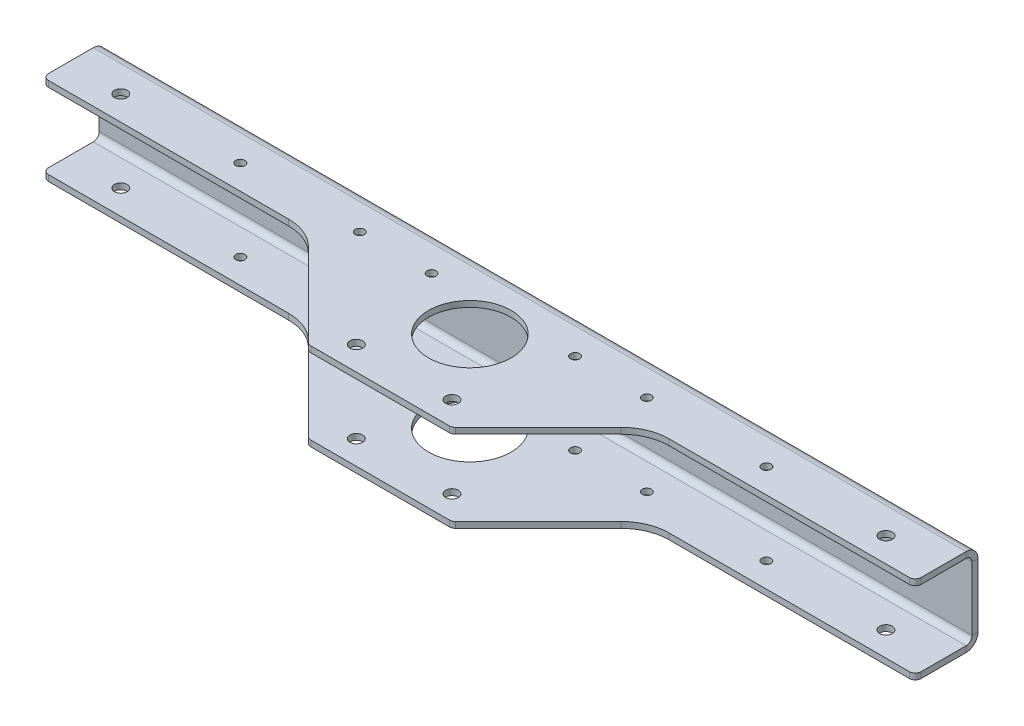
from build123d import *

# Parameters (mm, degrees)
BASE_FLANGE1_DEPTH = 463.55
SKETCH6_R          = 21.9075
CUT_EXTRUDE1_DEPTH = 474.696057033
CUT_EXTRUDE2_DEPTH = 474.696057033
SKETCH8_R          = 3.3782
SKETCH8_R_2        = 2.4257
CUT_EXTRUDE3_DEPTH = 474.696057033
SKETCH9_R          = 3.3782
CUT_EXTRUDE4_DEPTH = 474.696057033
FILLET1_R          = 25.4
FILLET2_R          = 3.175


# Sheet-metal steps are written as plain solids
with BuildPart() as part:
    # Sketch1 → Base-Flange1 (new body)
    with BuildSketch(Plane(origin=(0, 0, 0), x_dir=(0, 0, -1), z_dir=(1, 0, 0))):
        with BuildLine():
            Line((0, 0), (79.375, 0))
            ThreePointArc((79.375, 0), (81.62006403, 0.92993597), (82.55, 3.175))
            Line((82.55, 3.175), (82.55, 36.957))
            ThreePointArc((82.55, 36.957), (81.62006403, 39.20206403), (79.375, 40.132))
            Line((79.375, 40.132), (0, 40.132))
            Line((0, 40.132), (0, 43.307))
            Line((0, 43.307), (79.375, 43.307))
            ThreePointArc((79.375, 43.307), (83.865128061, 41.447128061), (85.725, 36.957))
            Line((85.725, 36.957), (85.725, 3.175))
            ThreePointArc((85.725, 3.175), (83.865128061, -1.315128061), (79.375, -3.175))
            Line((79.375, -3.175), (0, -3.175))
            Line((0, -3.175), (0, 0))
        make_face()
    extrude(amount=BASE_FLANGE1_DEPTH)

    # Sketch6 → Cut-Extrude1 (cut, through all)
    with BuildSketch(Plane(origin=(0, 43.307, 0), x_dir=(1, 0, 0), z_dir=(0, 1, 0))):
        with Locations(Location((231.775, 47.625, 0), (0, 0, 270))):
            Circle(SKETCH6_R)
    extrude(amount=-CUT_EXTRUDE1_DEPTH, mode=Mode.SUBTRACT)

    # Sketch7 → Cut-Extrude2 (cut, through all)
    with BuildSketch(Plane(origin=(0, 43.307, 0), x_dir=(1, 0, 0), z_dir=(0, 1, 0))):
        Polygon((141.2748, 52.4002), (0, 52.4002), (0, 0), (193.675, 0), align=None)
        Polygon((322.2752, 52.4002), (269.875, 0), (463.55, 0), (463.55, 52.4002), align=None)
    extrude(amount=-CUT_EXTRUDE2_DEPTH, mode=Mode.SUBTRACT)

    # Sketch8 → Cut-Extrude3 (cut, through all)
    with BuildSketch(Plane(origin=(0, 43.307, 0), x_dir=(1, 0, 0), z_dir=(0, 1, 0))):
        with Locations(Location((28.575, 65.405, 0), (0, 0, 270))):
            Circle(SKETCH8_R)
        with Locations(Location((92.075, 65.405, 0), (0, 0, 270))):
            Circle(SKETCH8_R_2)
        with Locations(Location((193.675, 65.405, 0), (0, 0, 270))):
            Circle(SKETCH8_R_2)
        with Locations(Location((269.875, 65.405, 0), (0, 0, 270))):
            Circle(SKETCH8_R_2)
        with Locations(Location((371.475, 65.405, 0), (0, 0, 270))):
            Circle(SKETCH8_R_2)
        with Locations(Location((434.975, 65.405, 0), (0, 0, 270))):
            Circle(SKETCH8_R)
        with Locations(Location((155.575, 65.405, 0), (0, 0, 270))):
            Circle(SKETCH8_R_2)
        with Locations(Location((307.975, 65.405, 0), (0, 0, 270))):
            Circle(SKETCH8_R_2)
    extrude(amount=-CUT_EXTRUDE3_DEPTH, mode=Mode.SUBTRACT)

    # Sketch9 → Cut-Extrude4 (cut, through all)
    with BuildSketch(Plane(origin=(0, 43.307, 0), x_dir=(1, 0, 0), z_dir=(0, 1, 0))):
        with Locations(Location((257.175, 12.7, 0), (0, 0, 270))):
            Circle(SKETCH9_R)
        with Locations(Location((206.375, 12.7, 0), (0, 0, 270))):
            Circle(SKETCH9_R)
    extrude(amount=-CUT_EXTRUDE4_DEPTH, mode=Mode.SUBTRACT)

    # Fillet1
    fillet1_edges = [part.edges().sort_by_distance(p)[0] for p in [
        (141.2748, 41.7195, -52.4002),
        (141.2748, -1.5875, -52.4002),
        (322.2752, 41.7195, -52.4002),
        (322.2752, -1.5875, -52.4002),
    ]]
    fillet(fillet1_edges, radius=FILLET1_R)

    # Fillet2
    fillet2_edges = [part.edges().sort_by_distance(p)[0] for p in [
        (0, 41.7195, -52.4002),
        (193.675, 41.7195, 0),
        (193.675, -1.5875, 0),
        (0, -1.5875, -52.4002),
        (463.55, 41.7195, -52.4002),
        (269.875, 41.7195, 0),
        (463.55, -1.5875, -52.4002),
        (269.875, -1.5875, 0),
    ]]
    fillet(fillet2_edges, radius=FILLET2_R)


solid = part.part
